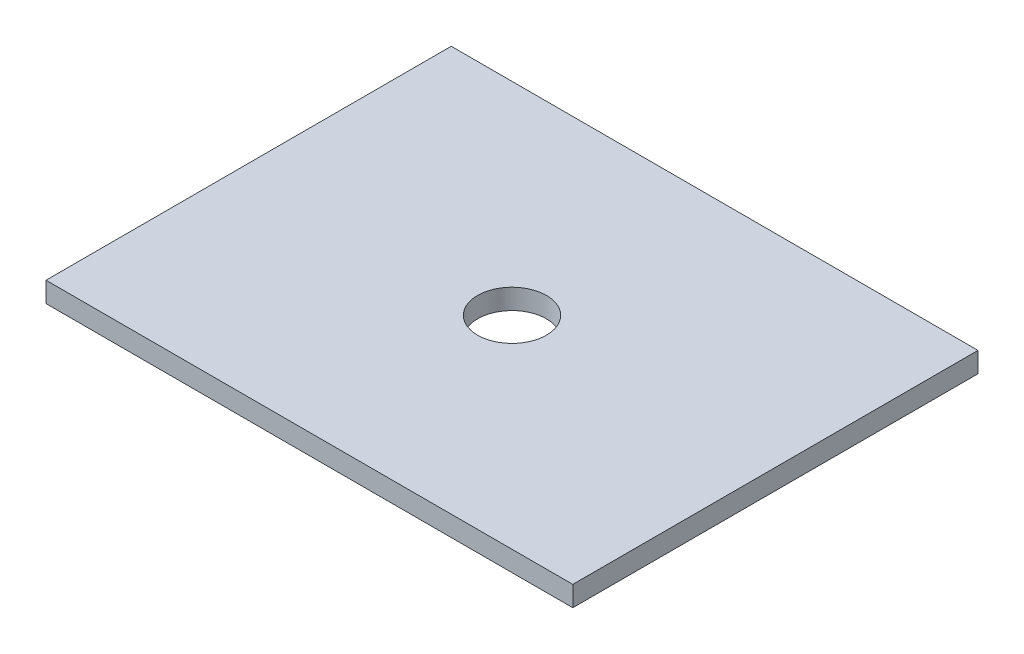
from build123d import *

# Parameters (mm, degrees)
SK_PAD_W        = 26
SK_PAD_H        = 20
SM_PAD_DEPTH    = 1
SK_SCREW_R      = 1.7
CUT_SCREW_DEPTH = 1


# Sheet-metal steps are written as plain solids
with BuildPart() as part:
    # SK_Pad → SM_Pad (new body)
    with BuildSketch(Plane(origin=(0, 0, 0), x_dir=(1, 0, 0), z_dir=(0, 1, 0))):
        Rectangle(SK_PAD_W, SK_PAD_H)
    extrude(amount=SM_PAD_DEPTH)

    # SK_Screw → CUT_Screw (cut)
    with BuildSketch(Plane(origin=(0, 0, 0), x_dir=(1, 0, 0), z_dir=(0, 1, 0))):
        with Locations(Location((0, 0, 0), (0, 0, 270))):
            Circle(SK_SCREW_R)
    extrude(amount=CUT_SCREW_DEPTH, mode=Mode.SUBTRACT)


solid = part.part
